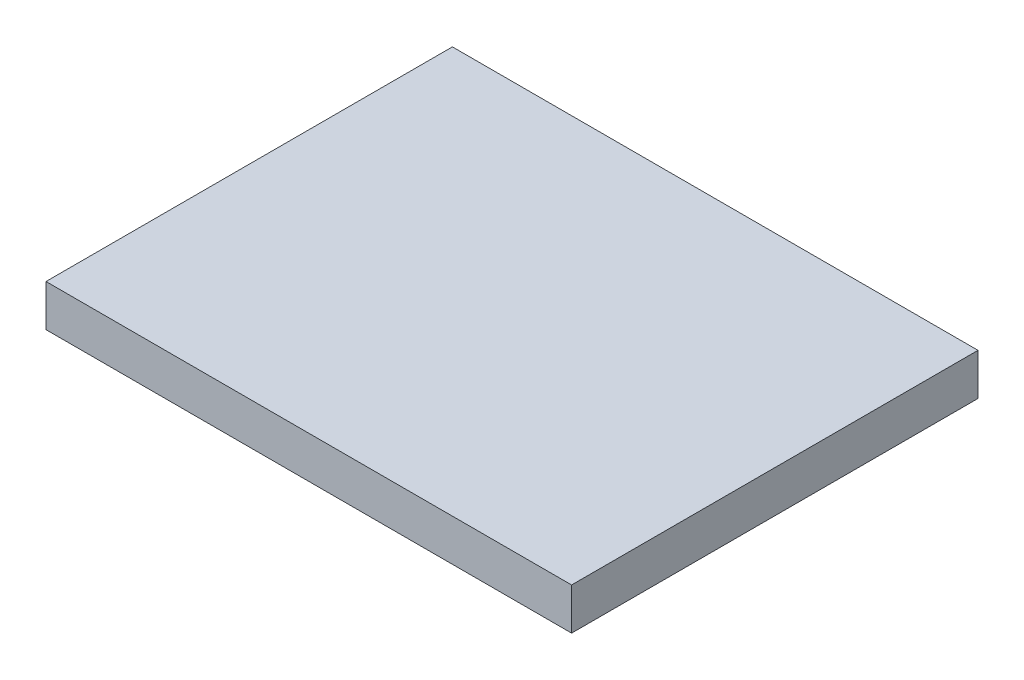
from build123d import *

# Parameters (mm, degrees)
SKETCH1_W           = 125.960284469
SKETCH1_H           = 97.393342316
BOSS_EXTRUDE1_DEPTH = 10


with BuildPart() as part:
    # Sketch1 → Boss-Extrude1 (new body)
    with BuildSketch(Plane(origin=(0, 0, 0), x_dir=(1, 0, 0), z_dir=(0, 1, 0))):
        with Locations((62.980142235, 48.696671158)):
            Rectangle(SKETCH1_W, SKETCH1_H)
    extrude(amount=BOSS_EXTRUDE1_DEPTH)


solid = part.part
